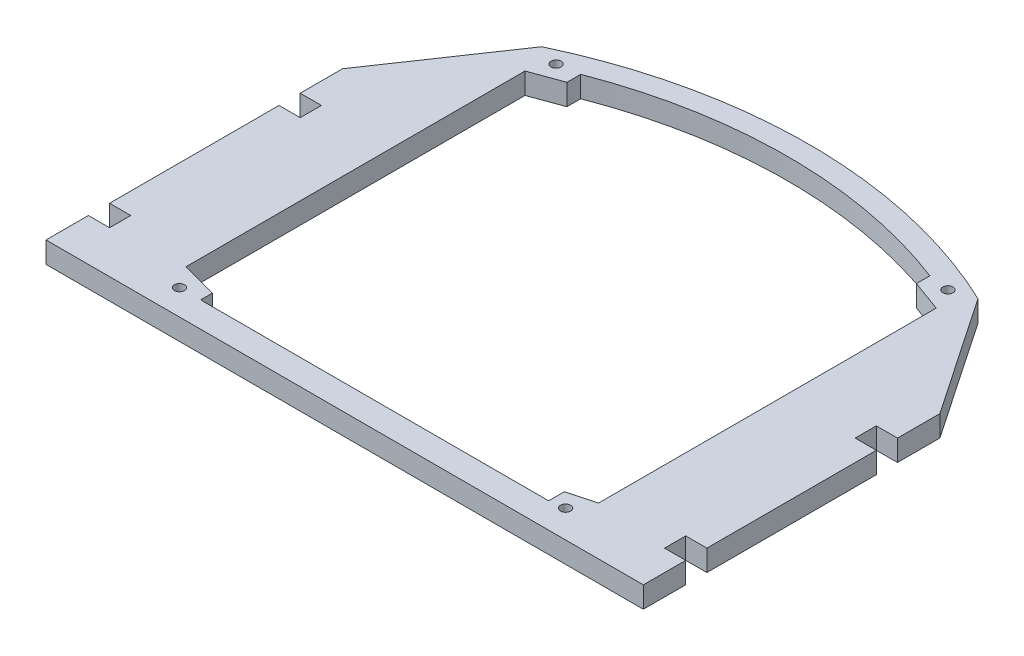
from build123d import *

# Parameters (mm, degrees)
SKETCH1_R           = 1.2
BOSS_EXTRUDE1_DEPTH = 5
CUT_EXTRUDE1_REACH  = 93.429
SKETCH2_W           = 5
SKETCH2_H           = 5


with BuildPart() as part:
    # Sketch1 → Boss-Extrude1 (new body)
    with BuildSketch(Plane(origin=(0, 0, 0), x_dir=(1, 0, 0), z_dir=(0, 1, 0))):
        with BuildLine():
            Line((-70.5, -58), (-70.5, 12))
            Line((-70.5, 12), (-51.5, 40))
            ThreePointArc((-51.5, 40), (0, 51.61296203), (51.5, 40))
            Line((51.5, 40), (70.5, 12))
            Line((70.5, 12), (70.5, -58))
            Line((70.5, -58), (-70.5, -58))
        make_face()
        with Locations((-46.25, 38.15)):
            Circle(SKETCH1_R, mode=Mode.SUBTRACT)
        with Locations((46.15, 38.25)):
            Circle(SKETCH1_R, mode=Mode.SUBTRACT)
        with Locations((45.65, -51.5)):
            Circle(SKETCH1_R, mode=Mode.SUBTRACT)
        with Locations((-45, -52)):
            Circle(SKETCH1_R, mode=Mode.SUBTRACT)
        with BuildLine():
            Line((-48.5, -46.921073105), (-48.5, 33.074355883))
            Line((-48.5, 33.074355883), (-41.25, 35.713140081))
            Line((-41.25, 35.713140081), (-41.25, 38.960237263))
            ThreePointArc((-41.25, 38.960237263), (-0.053554893, 46.612949559), (41.15, 38.998610512))
            Line((41.15, 38.998610512), (41.15, 35.813140081))
            Line((41.15, 35.813140081), (48.5, 33.13795886))
            Line((48.5, 33.13795886), (48.5, -46.59524008))
            Line((48.5, -46.59524008), (42.15, -48.296717452))
            Line((42.15, -48.296717452), (42.15, -52))
            Line((42.15, -52), (-40, -52))
            Line((-40, -52), (-40, -49.198641241))
            Line((-40, -49.198641241), (-48.5, -46.921073105))
        make_face(mode=Mode.SUBTRACT)
    extrude(amount=BOSS_EXTRUDE1_DEPTH)

    # Sketch2 → Cut-Extrude1 (cut, up to next)
    with BuildSketch(Plane(origin=(0, 5, 0), x_dir=(1, 0, 0), z_dir=(0, 1, 0)), mode=Mode.PRIVATE) as cut_extrude1_sk1:
        with Locations((-68, -45.5)):
            Rectangle(SKETCH2_W, SKETCH2_H)
    cut_extrude1_tool1 = extrude(cut_extrude1_sk1.sketch, amount=-CUT_EXTRUDE1_REACH, mode=Mode.PRIVATE) & part.part
    # Sketch2 → Cut-Extrude1 (cut, up to next)
    with BuildSketch(Plane(origin=(0, 5, 0), x_dir=(1, 0, 0), z_dir=(0, 1, 0)), mode=Mode.PRIVATE) as cut_extrude1_sk2:
        with Locations((-68, -0.5)):
            Rectangle(SKETCH2_W, SKETCH2_H)
    cut_extrude1_tool2 = extrude(cut_extrude1_sk2.sketch, amount=-CUT_EXTRUDE1_REACH, mode=Mode.PRIVATE) & part.part
    cut_extrude1_1 = cut_extrude1_tool1.solids().sort_by_distance((-68, 5, 45.5))[0]
    add(cut_extrude1_1, mode=Mode.SUBTRACT)
    cut_extrude1_2 = cut_extrude1_tool2.solids().sort_by_distance((-68, 5, 0.5))[0]
    add(cut_extrude1_2, mode=Mode.SUBTRACT)
    cut_extrude1 = cut_extrude1_1 + cut_extrude1_2  # Cut-Extrude1 as one shape, for the pattern or mirror that repeats it

    # Mirror1: Cut-Extrude1 across plane
    add(cut_extrude1.mirror(Plane(origin=(0, 0, 0), x_dir=(0, 0, 1), z_dir=(1, 0, 0))), mode=Mode.SUBTRACT)


solid = part.part
